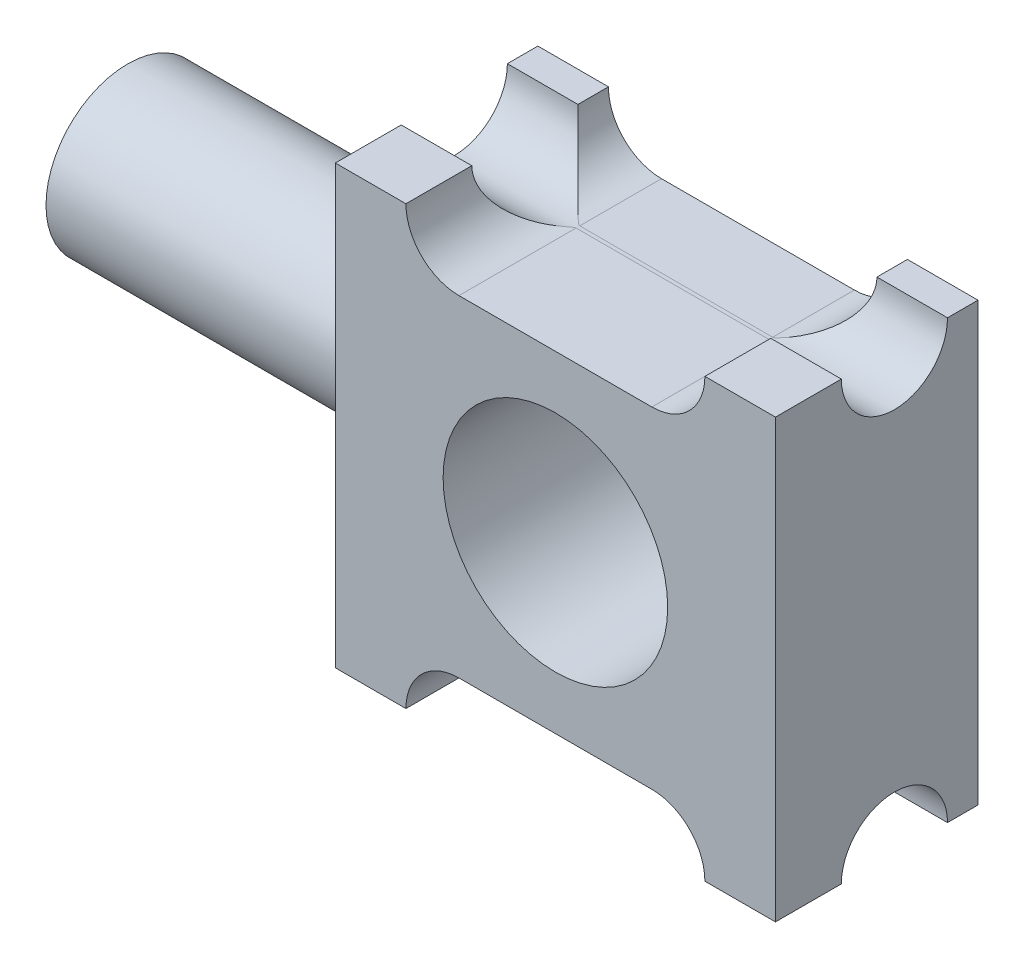
from build123d import *

# Parameters (mm, degrees)
SKETCH1_W           = 13.6906
SKETCH1_H           = 13.6
BOSS_EXTRUDE1_DEPTH = 6.3
SKETCH2_R           = 1.651
CUT_EXTRUDE1_DEPTH  = 17.533678609
CUT_EXTRUDE2_DEPTH  = 12.523373295
SKETCH4_R           = 3.4925
CUT_EXTRUDE3_DEPTH  = 12.523373468
SKETCH5_R           = 2.54
BOSS_EXTRUDE2_DEPTH = 10.16


with BuildPart() as part:
    # Sketch1 → Boss-Extrude1 (new body)
    with BuildSketch(Plane.XY):
        Rectangle(SKETCH1_W, SKETCH1_H)
    extrude(amount=BOSS_EXTRUDE1_DEPTH)

    # Sketch2 → Cut-Extrude1 (cut, through all)
    with BuildSketch(Plane(origin=(6.8453, 0, 0), x_dir=(0, 0, -1), z_dir=(1, 0, 0))):
        with Locations((-2.6, 6.8)):
            Circle(SKETCH2_R)
        with Locations((-2.6, -6.8)):
            Circle(SKETCH2_R)
    extrude(amount=-CUT_EXTRUDE1_DEPTH, mode=Mode.SUBTRACT)

    # Sketch3 → Cut-Extrude2 (cut, through all)
    with BuildSketch(Plane.XY.offset(6.3)):
        with BuildLine():
            ThreePointArc((-4.65, 6.8), (-4.166726189, 5.633273811), (-3, 5.15))
            Line((-3, 5.15), (3, 5.15))
            ThreePointArc((3, 5.15), (4.166726189, 5.633273811), (4.65, 6.8))
            Line((4.65, 6.8), (-4.65, 6.8))
        make_face()
        with BuildLine():
            ThreePointArc((4.65, -6.8), (4.166726189, -5.633273811), (3, -5.15))
            Line((3, -5.15), (-3, -5.15))
            ThreePointArc((-3, -5.15), (-4.166726189, -5.633273811), (-4.65, -6.8))
            Line((-4.65, -6.8), (4.65, -6.8))
        make_face()
    extrude(amount=-CUT_EXTRUDE2_DEPTH, mode=Mode.SUBTRACT)

    # Sketch4 → Cut-Extrude3 (cut, through all)
    with BuildSketch(Plane.XY.offset(6.3)):
        Circle(SKETCH4_R)
    extrude(amount=-CUT_EXTRUDE3_DEPTH, mode=Mode.SUBTRACT)

    # Sketch5 → Boss-Extrude2 (add)
    with BuildSketch(Plane.ZY.offset(6.8453)):
        with Locations((2.6, 0)):
            Circle(SKETCH5_R)
    extrude(amount=BOSS_EXTRUDE2_DEPTH)


solid = part.part
